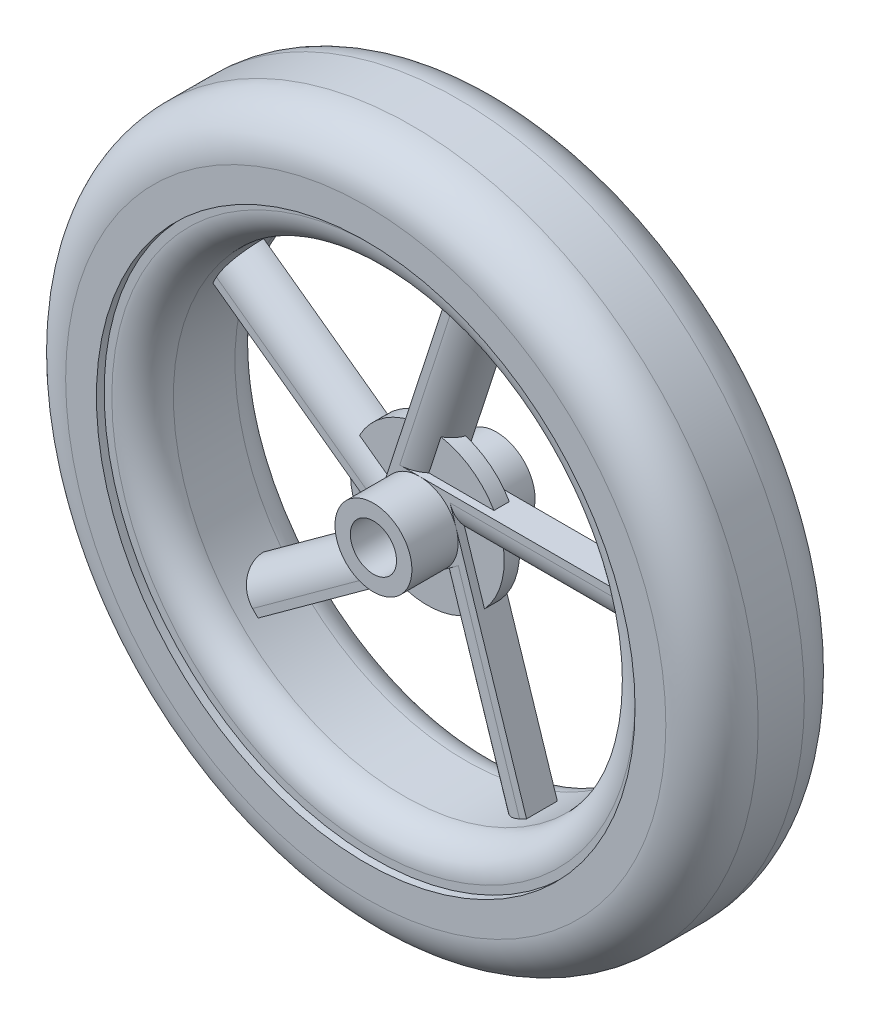
from build123d import *
from build123d.topology import SkipClean

# Parameters (mm, degrees)
SKETCH2_R           = 2.5
SKETCH2_R_2         = 1.5
BOSS_EXTRUDE1_DEPTH = 4
SKETCH3_R           = 17.5
SKETCH3_R_2         = 15
BOSS_EXTRUDE2_DEPTH = 4
SKETCH4_R           = 2.5
BOSS_EXTRUDE3_DEPTH = 1
SKETCH5_R           = 5
SKETCH5_R_2         = 2.5
BOSS_EXTRUDE4_DEPTH = 0.5
FILLET1_R           = 2
FILLET2_R           = 2
SKETCH6_R           = 22.5
SKETCH6_R_2         = 17.5
BOSS_EXTRUDE5_DEPTH = 4.5
FILLET3_R           = 3


with BuildPart() as part:
    # Sketch2 → Boss-Extrude1 (new, symmetric)
    with BuildSketch(Plane.XY):
        Circle(SKETCH2_R)
        Circle(SKETCH2_R_2, mode=Mode.SUBTRACT)
    extrude(amount=BOSS_EXTRUDE1_DEPTH, both=True)



with BuildPart() as body_2:
    # Sketch3 → Boss-Extrude2 (new, symmetric)
    with BuildSketch(Plane.XY):
        Circle(SKETCH3_R)
        Circle(SKETCH3_R_2, mode=Mode.SUBTRACT)
    extrude(amount=BOSS_EXTRUDE2_DEPTH, both=True)


with BuildPart() as part_1:
    add(part.part)

    add(body_2.part)  # Boss-Extrude3 merges body 2
    # Sketch4 → Boss-Extrude3 (add, symmetric)
    with BuildSketch(Plane.XY):
        with BuildLine():
            Line((0.812299241, 2.5), (14.790199458, 2.5))
            ThreePointArc((14.790199458, 2.5), (14.947457842, 1.254393904), (15, 0))
            Line((15, 0), (2.628655561, 0))
            Line((2.628655561, 0), (6.948064273, -13.293773086))
            ThreePointArc((6.948064273, -13.293773086), (5.812017992, -13.828248148), (4.635254916, -14.265847744))
            Line((4.635254916, -14.265847744), (0.812299241, -2.5))
            Line((0.812299241, -2.5), (-10.496059581, -10.716003606))
            ThreePointArc((-10.496059581, -10.716003606), (-11.355433179, -9.800721265), (-12.135254916, -8.816778784))
            Line((-12.135254916, -8.816778784), (-2.126627021, -1.545084972))
            Line((-2.126627021, -1.545084972), (-13.434985842, 6.670918634))
            ThreePointArc((-13.434985842, 6.670918634), (-12.830061654, 7.771069293), (-12.135254916, 8.816778784))
            Line((-12.135254916, 8.816778784), (-2.126627021, 1.545084972))
            Line((-2.126627021, 1.545084972), (2.192781692, 14.838858058))
            ThreePointArc((2.192781692, 14.838858058), (3.426018999, 14.603506217), (4.635254916, 14.265847744))
            Line((4.635254916, 14.265847744), (0.812299241, 2.5))
        make_face()
        Circle(SKETCH4_R, mode=Mode.SUBTRACT)
    extrude(amount=BOSS_EXTRUDE3_DEPTH, both=True)

    # Sketch5 → Boss-Extrude4 (add, symmetric)
    with BuildSketch(Plane.XY):
        Circle(SKETCH5_R)
        Circle(SKETCH5_R_2, mode=Mode.SUBTRACT)
    extrude(amount=BOSS_EXTRUDE4_DEPTH, both=True)

    # Fillet1
    fillet1_edges = [part_1.edges().sort_by_distance(p)[0] for p in [
        (-15, 0, 4),
        (-15, 0, -4),
    ]]
    fillet(fillet1_edges, radius=FILLET1_R)

    # Fillet2
    # the kernel refuses this fillet: 2 mm, written as the material it takes off along each edge
    with BuildSketch(Plane(origin=(-16.180339887, -11.755705046, 1), x_dir=(0.5877852522924676, -0.8090169943749516, 0), z_dir=(0.8090169943749516, 0.5877852522924676, 0))) as fillet2_piece_1_section:
        with BuildLine():
            CenterArc((FILLET2_R, FILLET2_R), FILLET2_R, 180, 90)
            Line((0, FILLET2_R), (0, 0))
            Line((0, 0), (FILLET2_R, 0))
        make_face()
    fillet2_piece_1 = extrude(amount=22.371344439, mode=Mode.PRIVATE)
    fillet2_piece_1 = fillet2_piece_1 & Plane(origin=(0, 0, 0.789788575), x_dir=(1, 0, 0), z_dir=(0, 0, -1)) * Cylinder(15, 53, mode=Mode.PRIVATE)
    fillet2_piece_1 = split(fillet2_piece_1, bisect_by=Plane(origin=(-3.505962459, -0.542939116, 0.789788575), z_dir=(-0.5877852522924808, -0.809016994374942, 0)), keep=Keep.TOP, mode=Mode.PRIVATE)
    fillet2_piece_1 = split(fillet2_piece_1, bisect_by=Plane(origin=(-7.715238997, -6.336511241, 0.5), z_dir=(0, 0, 1)), keep=Keep.TOP, mode=Mode.PRIVATE)
    add(fillet2_piece_1, mode=Mode.SUBTRACT)
    with BuildSketch(Plane(origin=(-16.180339887, -11.755705046, 1), x_dir=(0.5877852522924676, -0.8090169943749516, 0), z_dir=(0.8090169943749516, 0.5877852522924676, 0))) as fillet2_piece_2_section:
        with BuildLine():
            CenterArc((FILLET2_R, FILLET2_R), FILLET2_R, 180, 90)
            Line((0, FILLET2_R), (0, 0))
            Line((0, 0), (FILLET2_R, 0))
        make_face()
    fillet2_piece_2 = extrude(amount=22.371344439, mode=Mode.PRIVATE)
    fillet2_piece_2 = fillet2_piece_2 & Plane(origin=(0, 0, 0.165607545), x_dir=(1, 0, 0), z_dir=(0, 0, -1)) * Cylinder(15, 53, mode=Mode.PRIVATE)
    fillet2_piece_2 = fillet2_piece_2 - Plane(origin=(0, 0, 0.165607545), x_dir=(1, 0, 0), z_dir=(0, 0, 1)) * Cylinder(5, 53, mode=Mode.PRIVATE)
    add(fillet2_piece_2, mode=Mode.SUBTRACT)
    with BuildSketch(Plane(origin=(-16.180339887, -11.755705046, 1), x_dir=(0.5877852522924676, -0.8090169943749516, 0), z_dir=(0.8090169943749516, 0.5877852522924676, 0))) as fillet2_piece_3_section:
        with BuildLine():
            CenterArc((FILLET2_R, FILLET2_R), FILLET2_R, 180, 90)
            Line((0, FILLET2_R), (0, 0))
            Line((0, 0), (FILLET2_R, 0))
        make_face()
    fillet2_piece_3 = extrude(amount=22.371344439, mode=Mode.PRIVATE)
    fillet2_piece_3 = split(fillet2_piece_3, bisect_by=Plane(origin=(-2.407624437, -1.340928399, -0.624492786), z_dir=(-0.5877852522924808, -0.809016994374942, 0)), keep=Keep.TOP, mode=Mode.PRIVATE)
    fillet2_piece_3 = split(fillet2_piece_3, bisect_by=Plane(origin=(-3.07214741, -2.255565805, -0.5), z_dir=(0, 0, -1)), keep=Keep.TOP, mode=Mode.PRIVATE)
    fillet2_piece_3 = fillet2_piece_3 & Plane(origin=(0, 0, -0.624492786), x_dir=(1, 0, 0), z_dir=(0, 0, 1)) * Cylinder(5, 53, mode=Mode.PRIVATE)
    add(fillet2_piece_3, mode=Mode.SUBTRACT)
    with BuildSketch(Plane(origin=(-16.180339887, -11.755705046, 1), x_dir=(0.5877852522924676, -0.8090169943749516, 0), z_dir=(0.8090169943749516, 0.5877852522924676, 0))) as fillet2_piece_4_section:
        with BuildLine():
            CenterArc((FILLET2_R, FILLET2_R), FILLET2_R, 180, 90)
            Line((0, FILLET2_R), (0, 0))
            Line((0, 0), (FILLET2_R, 0))
        make_face()
    fillet2_piece_4 = extrude(amount=22.371344439, mode=Mode.PRIVATE)
    fillet2_piece_4 = split(fillet2_piece_4, bisect_by=Plane(origin=(2.517761199, 0.34129775, 0.915192328), z_dir=(0.9510565162951545, 0.3090169943749446, 0)), keep=Keep.TOP, mode=Mode.PRIVATE)
    add(fillet2_piece_4, mode=Mode.SUBTRACT)
    with BuildSketch(Plane(origin=(6.180339887, -19.021130326, 1), x_dir=(0.9510565162951548, 0.30901699437494423, 0), z_dir=(-0.3090169943749442, 0.9510565162951546, 0))) as fillet2_piece_5_section:
        with BuildLine():
            CenterArc((FILLET2_R, FILLET2_R), FILLET2_R, 180, 90)
            Line((0, FILLET2_R), (0, 0))
            Line((0, 0), (FILLET2_R, 0))
        make_face()
    fillet2_piece_5 = extrude(amount=22.371344439, mode=Mode.PRIVATE)
    fillet2_piece_5 = fillet2_piece_5 & Plane(origin=(0, 0, 0.789788575), x_dir=(1, 0, 0), z_dir=(0, 0, -1)) * Cylinder(15, 53, mode=Mode.PRIVATE)
    fillet2_piece_5 = split(fillet2_piece_5, bisect_by=Plane(origin=(-0.567036197, -3.502145856, 0.789788575), z_dir=(0.5877852522924683, -0.809016994374951, 0)), keep=Keep.TOP, mode=Mode.PRIVATE)
    fillet2_piece_5 = split(fillet2_piece_5, bisect_by=Plane(origin=(3.64224034, -9.29571798, 0.5), z_dir=(0, 0, 1)), keep=Keep.TOP, mode=Mode.PRIVATE)
    add(fillet2_piece_5, mode=Mode.SUBTRACT)
    with BuildSketch(Plane(origin=(6.180339887, -19.021130326, 1), x_dir=(0.9510565162951548, 0.30901699437494423, 0), z_dir=(-0.3090169943749442, 0.9510565162951546, 0))) as fillet2_piece_6_section:
        with BuildLine():
            CenterArc((FILLET2_R, FILLET2_R), FILLET2_R, 180, 90)
            Line((0, FILLET2_R), (0, 0))
            Line((0, 0), (FILLET2_R, 0))
        make_face()
    fillet2_piece_6 = extrude(amount=22.371344439, mode=Mode.PRIVATE)
    fillet2_piece_6 = fillet2_piece_6 & Plane(origin=(0, 0, 0.165607542), x_dir=(1, 0, 0), z_dir=(0, 0, -1)) * Cylinder(15, 53, mode=Mode.PRIVATE)
    fillet2_piece_6 = fillet2_piece_6 - Plane(origin=(0, 0, 0.165607542), x_dir=(1, 0, 0), z_dir=(0, 0, 1)) * Cylinder(5, 53, mode=Mode.PRIVATE)
    add(fillet2_piece_6, mode=Mode.SUBTRACT)
    with BuildSketch(Plane(origin=(6.180339887, -19.021130326, 1), x_dir=(0.9510565162951548, 0.30901699437494423, 0), z_dir=(-0.3090169943749442, 0.9510565162951546, 0))) as fillet2_piece_7_section:
        with BuildLine():
            CenterArc((FILLET2_R, FILLET2_R), FILLET2_R, 180, 90)
            Line((0, FILLET2_R), (0, 0))
            Line((0, 0), (FILLET2_R, 0))
        make_face()
    fillet2_piece_7 = extrude(amount=22.371344439, mode=Mode.PRIVATE)
    fillet2_piece_7 = split(fillet2_piece_7, bisect_by=Plane(origin=(0.531301828, -2.704156571, -0.624492787), z_dir=(0.5877852522924683, -0.809016994374951, 0)), keep=Keep.TOP, mode=Mode.PRIVATE)
    fillet2_piece_7 = split(fillet2_piece_7, bisect_by=Plane(origin=(1.195824797, -3.618793972, -0.5), z_dir=(0, 0, -1)), keep=Keep.TOP, mode=Mode.PRIVATE)
    fillet2_piece_7 = fillet2_piece_7 & Plane(origin=(0, 0, -0.624492787), x_dir=(1, 0, 0), z_dir=(0, 0, 1)) * Cylinder(5, 53, mode=Mode.PRIVATE)
    add(fillet2_piece_7, mode=Mode.SUBTRACT)
    with BuildSketch(Plane(origin=(6.180339887, -19.021130326, 1), x_dir=(0.9510565162951548, 0.30901699437494423, 0), z_dir=(-0.3090169943749442, 0.9510565162951546, 0))) as fillet2_piece_8_section:
        with BuildLine():
            CenterArc((FILLET2_R, FILLET2_R), FILLET2_R, 180, 90)
            Line((0, FILLET2_R), (0, 0))
            Line((0, 0), (FILLET2_R, 0))
        make_face()
    fillet2_piece_8 = extrude(amount=22.371344439, mode=Mode.PRIVATE)
    fillet2_piece_8 = split(fillet2_piece_8, bisect_by=Plane(origin=(0.453437549, 2.5, 0.915192328), z_dir=(0, 1, 0)), keep=Keep.TOP, mode=Mode.PRIVATE)
    add(fillet2_piece_8, mode=Mode.SUBTRACT)
    with BuildSketch(Plane(origin=(20, 0, 1), x_dir=(0, 1, 0), z_dir=(-1, 0, 0))) as fillet2_piece_9_section:
        with BuildLine():
            CenterArc((FILLET2_R, FILLET2_R), FILLET2_R, 180, 90)
            Line((0, FILLET2_R), (0, 0))
            Line((0, 0), (FILLET2_R, 0))
        make_face()
    fillet2_piece_9 = extrude(amount=22.371344439, mode=Mode.PRIVATE)
    fillet2_piece_9 = fillet2_piece_9 & Plane(origin=(0, 0, 0.789788574), x_dir=(1, 0, 0), z_dir=(0, 0, -1)) * Cylinder(15, 53, mode=Mode.PRIVATE)
    fillet2_piece_9 = split(fillet2_piece_9, bisect_by=Plane(origin=(3.155514809, -1.621506036, 0.789788574), z_dir=(0.9510565162951545, 0.3090169943749446, 0)), keep=Keep.TOP, mode=Mode.PRIVATE)
    fillet2_piece_9 = split(fillet2_piece_9, bisect_by=Plane(origin=(9.966267249, 0.591441577, 0.5), z_dir=(0, 0, 1)), keep=Keep.TOP, mode=Mode.PRIVATE)
    add(fillet2_piece_9, mode=Mode.SUBTRACT)
    with BuildSketch(Plane(origin=(20, 0, 1), x_dir=(0, 1, 0), z_dir=(-1, 0, 0))) as fillet2_piece_10_section:
        with BuildLine():
            CenterArc((FILLET2_R, FILLET2_R), FILLET2_R, 180, 90)
            Line((0, FILLET2_R), (0, 0))
            Line((0, 0), (FILLET2_R, 0))
        make_face()
    fillet2_piece_10 = extrude(amount=22.371344439, mode=Mode.PRIVATE)
    fillet2_piece_10 = fillet2_piece_10 & Plane(origin=(0, 0, 0.165607617), x_dir=(1, 0, 0), z_dir=(0, 0, -1)) * Cylinder(15, 53, mode=Mode.PRIVATE)
    fillet2_piece_10 = fillet2_piece_10 - Plane(origin=(0, 0, 0.165607617), x_dir=(1, 0, 0), z_dir=(0, 0, 1)) * Cylinder(5, 53, mode=Mode.PRIVATE)
    add(fillet2_piece_10, mode=Mode.SUBTRACT)
    with BuildSketch(Plane(origin=(20, 0, 1), x_dir=(0, 1, 0), z_dir=(-1, 0, 0))) as fillet2_piece_11_section:
        with BuildLine():
            CenterArc((FILLET2_R, FILLET2_R), FILLET2_R, 180, 90)
            Line((0, FILLET2_R), (0, 0))
            Line((0, 0), (FILLET2_R, 0))
        make_face()
    fillet2_piece_11 = extrude(amount=22.371344439, mode=Mode.PRIVATE)
    fillet2_piece_11 = split(fillet2_piece_11, bisect_by=Plane(origin=(2.735987023, -0.330332276, -0.624492792), z_dir=(0.9510565162951545, 0.3090169943749446, 0)), keep=Keep.TOP, mode=Mode.PRIVATE)
    fillet2_piece_11 = fillet2_piece_11 & Plane(origin=(0, 0, -0.624492792), x_dir=(1, 0, 0), z_dir=(0, 0, 1)) * Cylinder(5, 53, mode=Mode.PRIVATE)
    fillet2_piece_11 = split(fillet2_piece_11, bisect_by=Plane(origin=(3.811207779, 0.019028125, -0.5), z_dir=(0, 0, -1)), keep=Keep.TOP, mode=Mode.PRIVATE)
    add(fillet2_piece_11, mode=Mode.SUBTRACT)
    with BuildSketch(Plane(origin=(20, 0, 1), x_dir=(0, 1, 0), z_dir=(-1, 0, 0))) as fillet2_piece_12_section:
        with BuildLine():
            CenterArc((FILLET2_R, FILLET2_R), FILLET2_R, 180, 90)
            Line((0, FILLET2_R), (0, 0))
            Line((0, 0), (FILLET2_R, 0))
        make_face()
    fillet2_piece_12 = extrude(amount=22.371344439, mode=Mode.PRIVATE)
    fillet2_piece_12 = split(fillet2_piece_12, bisect_by=Plane(origin=(-2.237521382, 1.203787222, 0.915192328), z_dir=(-0.95105651629515, 0.30901699437495883, 0)), keep=Keep.TOP, mode=Mode.PRIVATE)
    add(fillet2_piece_12, mode=Mode.SUBTRACT)
    with BuildSketch(Plane(origin=(6.180339887, 19.021130326, 1), x_dir=(-0.9510565162951493, 0.3090169943749605, 0), z_dir=(-0.3090169943749605, -0.9510565162951493, 0))) as fillet2_piece_13_section:
        with BuildLine():
            CenterArc((FILLET2_R, FILLET2_R), FILLET2_R, 180, 90)
            Line((0, FILLET2_R), (0, 0))
            Line((0, 0), (FILLET2_R, 0))
        make_face()
    fillet2_piece_13 = extrude(amount=22.371344439, mode=Mode.PRIVATE)
    fillet2_piece_13 = fillet2_piece_13 & Plane(origin=(0, 0, 0.789788575), x_dir=(1, 0, 0), z_dir=(0, 0, -1)) * Cylinder(15, 53, mode=Mode.PRIVATE)
    fillet2_piece_13 = split(fillet2_piece_13, bisect_by=Plane(origin=(2.517251606, 2.5, 0.789788575), z_dir=(0, 1, 0)), keep=Keep.TOP, mode=Mode.PRIVATE)
    fillet2_piece_13 = split(fillet2_piece_13, bisect_by=Plane(origin=(2.517251606, 9.661248979, 0.5), z_dir=(0, 0, 1)), keep=Keep.TOP, mode=Mode.PRIVATE)
    add(fillet2_piece_13, mode=Mode.SUBTRACT)
    with BuildSketch(Plane(origin=(6.180339887, 19.021130326, 1), x_dir=(-0.9510565162951493, 0.3090169943749605, 0), z_dir=(-0.3090169943749605, -0.9510565162951493, 0))) as fillet2_piece_14_section:
        with BuildLine():
            CenterArc((FILLET2_R, FILLET2_R), FILLET2_R, 180, 90)
            Line((0, FILLET2_R), (0, 0))
            Line((0, 0), (FILLET2_R, 0))
        make_face()
    fillet2_piece_14 = extrude(amount=22.371344439, mode=Mode.PRIVATE)
    fillet2_piece_14 = fillet2_piece_14 & Plane(origin=(0, 0, 0.165607543), x_dir=(1, 0, 0), z_dir=(0, 0, -1)) * Cylinder(15, 53, mode=Mode.PRIVATE)
    fillet2_piece_14 = fillet2_piece_14 - Plane(origin=(0, 0, 0.165607543), x_dir=(1, 0, 0), z_dir=(0, 0, 1)) * Cylinder(5, 53, mode=Mode.PRIVATE)
    add(fillet2_piece_14, mode=Mode.SUBTRACT)
    with BuildSketch(Plane(origin=(6.180339887, 19.021130326, 1), x_dir=(-0.9510565162951493, 0.3090169943749605, 0), z_dir=(-0.3090169943749605, -0.9510565162951493, 0))) as fillet2_piece_15_section:
        with BuildLine():
            CenterArc((FILLET2_R, FILLET2_R), FILLET2_R, 180, 90)
            Line((0, FILLET2_R), (0, 0))
            Line((0, 0), (FILLET2_R, 0))
        make_face()
    fillet2_piece_15 = extrude(amount=22.371344439, mode=Mode.PRIVATE)
    fillet2_piece_15 = split(fillet2_piece_15, bisect_by=Plane(origin=(1.159631148, 2.5, -0.624492787), z_dir=(0, 1, 0)), keep=Keep.TOP, mode=Mode.PRIVATE)
    fillet2_piece_15 = split(fillet2_piece_15, bisect_by=Plane(origin=(1.159631148, 3.630554003, -0.5), z_dir=(0, 0, -1)), keep=Keep.TOP, mode=Mode.PRIVATE)
    fillet2_piece_15 = fillet2_piece_15 & Plane(origin=(0, 0, -0.624492787), x_dir=(1, 0, 0), z_dir=(0, 0, 1)) * Cylinder(5, 53, mode=Mode.PRIVATE)
    add(fillet2_piece_15, mode=Mode.SUBTRACT)
    with BuildSketch(Plane(origin=(6.180339887, 19.021130326, 1), x_dir=(-0.9510565162951493, 0.3090169943749605, 0), z_dir=(-0.3090169943749605, -0.9510565162951493, 0))) as fillet2_piece_16_section:
        with BuildLine():
            CenterArc((FILLET2_R, FILLET2_R), FILLET2_R, 180, 90)
            Line((0, FILLET2_R), (0, 0))
            Line((0, 0), (FILLET2_R, 0))
        make_face()
    fillet2_piece_16 = extrude(amount=22.371344439, mode=Mode.PRIVATE)
    fillet2_piece_16 = split(fillet2_piece_16, bisect_by=Plane(origin=(-1.836301814, -1.756018582, 0.915192328), z_dir=(-0.5877852522924808, -0.809016994374942, 0)), keep=Keep.TOP, mode=Mode.PRIVATE)
    add(fillet2_piece_16, mode=Mode.SUBTRACT)
    with BuildSketch(Plane(origin=(-16.180339887, 11.755705046, 1), x_dir=(-0.5877852522924818, -0.8090169943749412, 0), z_dir=(0.8090169943749412, -0.5877852522924817, 0))) as fillet2_piece_17_section:
        with BuildLine():
            CenterArc((FILLET2_R, FILLET2_R), FILLET2_R, 180, 90)
            Line((0, FILLET2_R), (0, 0))
            Line((0, 0), (FILLET2_R, 0))
        make_face()
    fillet2_piece_17 = extrude(amount=22.371344439, mode=Mode.PRIVATE)
    fillet2_piece_17 = fillet2_piece_17 & Plane(origin=(0, 0, 0.789788575), x_dir=(1, 0, 0), z_dir=(0, 0, -1)) * Cylinder(15, 53, mode=Mode.PRIVATE)
    fillet2_piece_17 = split(fillet2_piece_17, bisect_by=Plane(origin=(-1.599767765, 3.166591029, 0.789788575), z_dir=(-0.95105651629515, 0.30901699437495883, 0)), keep=Keep.TOP, mode=Mode.PRIVATE)
    fillet2_piece_17 = split(fillet2_piece_17, bisect_by=Plane(origin=(-8.410520272, 5.379538664, 0.5), z_dir=(0, 0, 1)), keep=Keep.TOP, mode=Mode.PRIVATE)
    add(fillet2_piece_17, mode=Mode.SUBTRACT)
    with BuildSketch(Plane(origin=(-16.180339887, 11.755705046, 1), x_dir=(-0.5877852522924818, -0.8090169943749412, 0), z_dir=(0.8090169943749412, -0.5877852522924817, 0))) as fillet2_piece_18_section:
        with BuildLine():
            CenterArc((FILLET2_R, FILLET2_R), FILLET2_R, 180, 90)
            Line((0, FILLET2_R), (0, 0))
            Line((0, 0), (FILLET2_R, 0))
        make_face()
    fillet2_piece_18 = extrude(amount=22.371344439, mode=Mode.PRIVATE)
    fillet2_piece_18 = fillet2_piece_18 & Plane(origin=(0, 0, 0.165607546), x_dir=(1, 0, 0), z_dir=(0, 0, -1)) * Cylinder(15, 53, mode=Mode.PRIVATE)
    fillet2_piece_18 = fillet2_piece_18 - Plane(origin=(0, 0, 0.165607546), x_dir=(1, 0, 0), z_dir=(0, 0, 1)) * Cylinder(5, 53, mode=Mode.PRIVATE)
    add(fillet2_piece_18, mode=Mode.SUBTRACT)
    with BuildSketch(Plane(origin=(-16.180339887, 11.755705046, 1), x_dir=(-0.5877852522924818, -0.8090169943749412, 0), z_dir=(0.8090169943749412, -0.5877852522924817, 0))) as fillet2_piece_19_section:
        with BuildLine():
            CenterArc((FILLET2_R, FILLET2_R), FILLET2_R, 180, 90)
            Line((0, FILLET2_R), (0, 0))
            Line((0, 0), (FILLET2_R, 0))
        make_face()
    fillet2_piece_19 = extrude(amount=22.371344439, mode=Mode.PRIVATE)
    fillet2_piece_19 = split(fillet2_piece_19, bisect_by=Plane(origin=(-2.019295559, 1.875417246, -0.624492786), z_dir=(-0.95105651629515, 0.30901699437495883, 0)), keep=Keep.TOP, mode=Mode.PRIVATE)
    fillet2_piece_19 = split(fillet2_piece_19, bisect_by=Plane(origin=(-3.094516315, 2.224777647, -0.5), z_dir=(0, 0, -1)), keep=Keep.TOP, mode=Mode.PRIVATE)
    fillet2_piece_19 = fillet2_piece_19 & Plane(origin=(0, 0, -0.624492786), x_dir=(1, 0, 0), z_dir=(0, 0, 1)) * Cylinder(5, 53, mode=Mode.PRIVATE)
    add(fillet2_piece_19, mode=Mode.SUBTRACT)
    with BuildSketch(Plane(origin=(-16.180339887, 11.755705046, 1), x_dir=(-0.5877852522924818, -0.8090169943749412, 0), z_dir=(0.8090169943749412, -0.5877852522924817, 0))) as fillet2_piece_20_section:
        with BuildLine():
            CenterArc((FILLET2_R, FILLET2_R), FILLET2_R, 180, 90)
            Line((0, FILLET2_R), (0, 0))
            Line((0, 0), (FILLET2_R, 0))
        make_face()
    fillet2_piece_20 = extrude(amount=22.371344439, mode=Mode.PRIVATE)
    fillet2_piece_20 = split(fillet2_piece_20, bisect_by=Plane(origin=(1.102624448, -2.28906639, 0.915192328), z_dir=(0.5877852522924683, -0.809016994374951, 0)), keep=Keep.TOP, mode=Mode.PRIVATE)
    add(fillet2_piece_20, mode=Mode.SUBTRACT)

    # Sketch6 → Boss-Extrude5 (add, symmetric)
    with SkipClean():  # the faces are left unmerged after this step: merging them gives an invalid solid
        with BuildSketch(Plane.XY):
            Circle(SKETCH6_R)
            Circle(SKETCH6_R_2, mode=Mode.SUBTRACT)
        extrude(amount=BOSS_EXTRUDE5_DEPTH, both=True)

    # Fillet3
    fillet3_edges = [part_1.edges().sort_by_distance(p)[0] for p in [
        (-22.5, 0, 4.5),
        (-22.5, 0, -4.5),
    ]]
    fillet(fillet3_edges, radius=FILLET3_R)


solid = part_1.part
